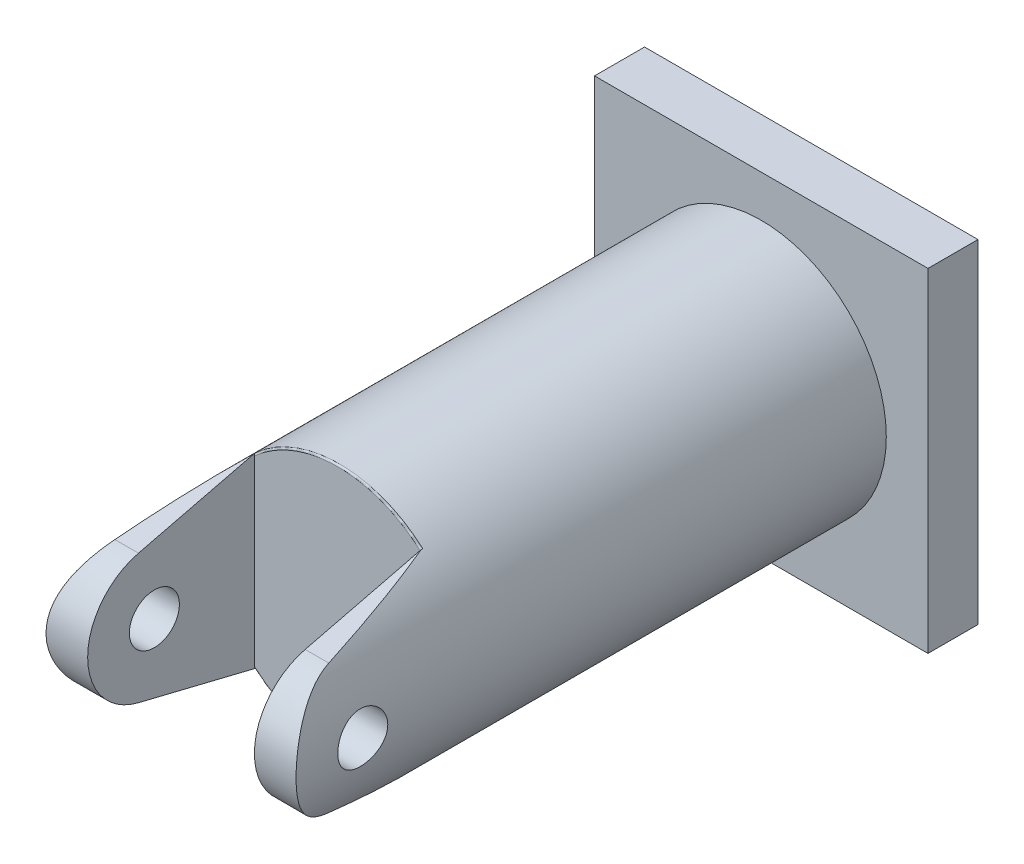
from build123d import *

# Parameters (mm, degrees)
SKETCH1_R               = 7.5
BOSS_EXTRUDE1_DEPTH     = 35.4
SKETCH3_W               = 10
SKETCH3_H               = 16
CUT_EXTRUDE2_DEPTH      = 10
CUT_EXTRUDE3_DEPTH      = 37.954837302
CUT_EXTRUDE3_DEPTH_BACK = 37.954837302
CUT_EXTRUDE4_DEPTH      = 37.954837438
CUT_EXTRUDE4_DEPTH_BACK = 37.954837438
SKETCH5_R               = 1.5
FILLET1_R               = 0.1
SKETCH6_W               = 20
SKETCH6_H               = 20
BOSS_EXTRUDE2_DEPTH     = 3


with BuildPart() as part:
    # Sketch1 → Boss-Extrude1 (new body)
    with BuildSketch(Plane.XY):
        Circle(SKETCH1_R)
    extrude(amount=BOSS_EXTRUDE1_DEPTH)

    # Sketch3 → Cut-Extrude2 (cut)
    with BuildSketch(Plane.XY.offset(35.4)):
        Rectangle(SKETCH3_W, SKETCH3_H)
    extrude(amount=-CUT_EXTRUDE2_DEPTH, mode=Mode.SUBTRACT)

    # Sketch4 → Cut-Extrude3 (cut, two sides: drawn at the far end of the back side and taken through both)
    with BuildSketch(Plane(origin=(0, 0, 0), x_dir=(0, 0, -1), z_dir=(1, 0, 0)).offset(-CUT_EXTRUDE3_DEPTH_BACK)):
        with BuildLine():
            Line((-25.4, 76.496949074), (-25.4, 7.5))
            Line((-25.4, 7.5), (-25.4, 5.590169944))
            Line((-25.4, 5.590169944), (-32.352923855, 3.884664175))
            ThreePointArc((-32.352923855, 3.884664175), (-35.399999999, -0.000262165), (-32.352744721, -3.885047998))
            Line((-32.352744721, -3.885047998), (-25.4, -5.590169944))
            Line((-25.4, -5.590169944), (-25.4, -7.5))
            Line((-25.4, -7.5), (-25.4, -76.496949074))
            Line((-25.4, -76.496949074), (-163.393898147, -76.496949074))
            Line((-163.393898147, -76.496949074), (-163.393898147, 76.496949074))
            Line((-163.393898147, 76.496949074), (-25.4, 76.496949074))
        make_face()
    extrude(amount=CUT_EXTRUDE3_DEPTH + CUT_EXTRUDE3_DEPTH_BACK, mode=Mode.SUBTRACT)

    # Sketch5 → Cut-Extrude4 (cut, two sides: drawn at the far end of the back side and taken through both)
    with BuildSketch(Plane(origin=(0, 0, 0), x_dir=(0, 0, -1), z_dir=(1, 0, 0)).offset(-CUT_EXTRUDE4_DEPTH_BACK)):
        with Locations(Location((-31.4, -0.000169944, 0), (0, 0, 0.006491373))):
            Circle(SKETCH5_R)
    extrude(amount=CUT_EXTRUDE4_DEPTH + CUT_EXTRUDE4_DEPTH_BACK, mode=Mode.SUBTRACT)

    # Fillet1
    # the kernel refuses this fillet: 0.1 mm, written as the material it takes off along each edge
    with BuildSketch(Plane(origin=(0, 0, 25.4), x_dir=(0.6911452834399253, -0.7227158481580055, 0), z_dir=(0.7227158481580055, 0.6911452834399253, 0))) as fillet1_piece_1_section:
        with BuildLine():
            CenterArc((7.5 - FILLET1_R, FILLET1_R), FILLET1_R, 270, 90)
            Line((7.5 - FILLET1_R, 0), (7.5, 0))
            Line((7.5, 0), (7.5, FILLET1_R))
        make_face()
    fillet1_piece_1 = revolve(axis=Axis((0, 0, 25.4), (0, 0, -1)), revolution_arc=87.441672972, mode=Mode.PRIVATE)
    fillet1_piece_1 = split(fillet1_piece_1, bisect_by=Plane(origin=(5, -5.569278589, 25.383070115), z_dir=(-1, 0, 0)), keep=Keep.TOP, mode=Mode.PRIVATE)
    fillet1_piece_1 = split(fillet1_piece_1, bisect_by=Plane(origin=(-5, -5.569278589, 25.383070115), z_dir=(1, 0, 0)), keep=Keep.TOP, mode=Mode.PRIVATE)
    add(fillet1_piece_1, mode=Mode.SUBTRACT)
    with BuildSketch(Plane(origin=(0, 0, 25.4), x_dir=(-0.6911452834399255, 0.7227158481580054, 0), z_dir=(-0.7227158481580054, -0.6911452834399255, 0))) as fillet1_piece_2_section:
        with BuildLine():
            CenterArc((7.5 - FILLET1_R, FILLET1_R), FILLET1_R, 270, 90)
            Line((7.5 - FILLET1_R, 0), (7.5, 0))
            Line((7.5, 0), (7.5, FILLET1_R))
        make_face()
    fillet1_piece_2 = revolve(axis=Axis((0, 0, 25.4), (0, 0, -1)), revolution_arc=87.441672972, mode=Mode.PRIVATE)
    fillet1_piece_2 = split(fillet1_piece_2, bisect_by=Plane(origin=(5, 5.569279486, 25.383069507), z_dir=(-1, 0, 0)), keep=Keep.TOP, mode=Mode.PRIVATE)
    fillet1_piece_2 = split(fillet1_piece_2, bisect_by=Plane(origin=(-5, 5.569279486, 25.383069507), z_dir=(1, 0, 0)), keep=Keep.TOP, mode=Mode.PRIVATE)
    add(fillet1_piece_2, mode=Mode.SUBTRACT)

    # Sketch6 → Boss-Extrude2 (add)
    with BuildSketch(Plane(origin=(0, 0, 0), x_dir=(-1, 0, 0), z_dir=(0, 0, -1))):
        Rectangle(SKETCH6_W, SKETCH6_H)
    extrude(amount=BOSS_EXTRUDE2_DEPTH)


solid = part.part
